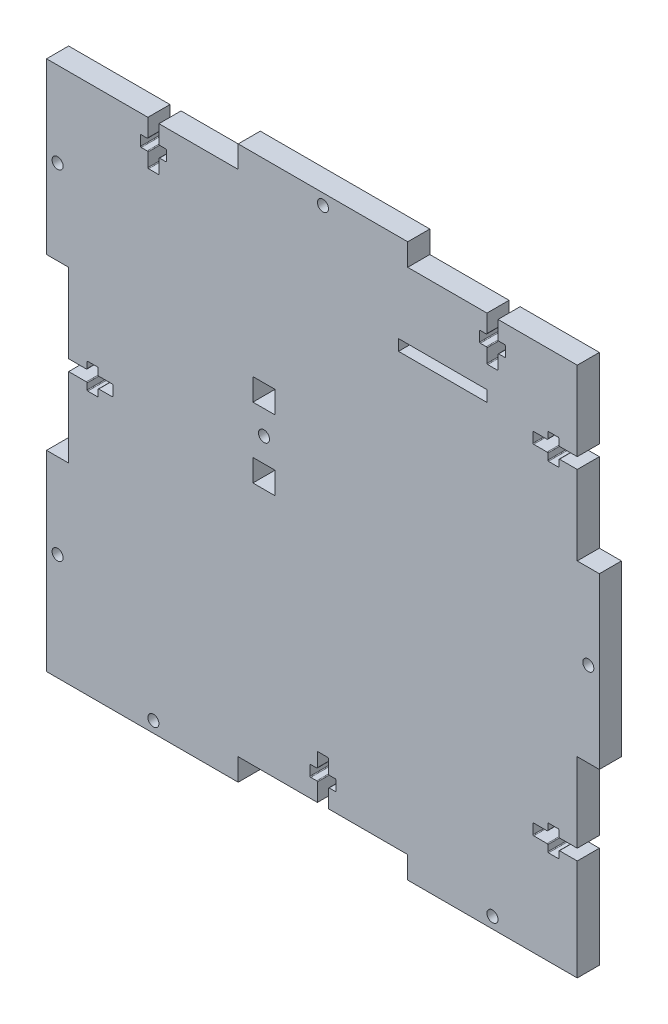
from build123d import *

# Parameters (mm, degrees)
BOX_SIDE_DEPTH       = 6
SKETCH2_R            = 1.5
SCREW_CUT_OUTS_DEPTH = 107.235587258
SKETCH3_R            = 1.5
SKETCH3_W            = 24
SKETCH3_H            = 3
SKETCH3_W_2          = 6
SKETCH3_H_2          = 6
GROOVES_DEPTH        = 107.235587258


with BuildPart() as part:
    # Sketch1 → Box Side (new body)
    with BuildSketch(Plane.XY):
        Polygon((-69, 69), (-23, 69), (-23, 75), (23, 75), (23, 69), (69, 69), (69, 23), (75, 23), (75, -23), (69, -23), (69, -69), (69, -75), (23, -75), (23, -69), (-23, -69), (-23, -75), (-69, -75), (-75, -75), (-75, -69), (-75, -23), (-69, -23), (-69, 23), (-75, 23), (-75, 69), align=None)
    extrude(amount=BOX_SIDE_DEPTH)

    # Sketch2 → Screw Cut-outs (cut, through all)
    with BuildSketch(Plane.XY.offset(6)):
        with Locations((0, 72)):
            Circle(SKETCH2_R)
        with Locations((72, 0)):
            Circle(SKETCH2_R)
        with Locations((-46, -72)):
            Circle(SKETCH2_R)
        with Locations((46, -72)):
            Circle(SKETCH2_R)
        with Locations((-72, 46)):
            Circle(SKETCH2_R)
        with Locations((-72, -46)):
            Circle(SKETCH2_R)
        with BuildLine():
            Line((-44.5, 69), (-44.5, 64.2))
            ThreePointArc((-44.5, 64.2), (-44.441421356, 64.058578644), (-44.3, 64))
            Line((-44.3, 64), (-42.7, 64))
            ThreePointArc((-42.7, 64), (-42.558578644, 63.941421356), (-42.5, 63.8))
            Line((-42.5, 63.8), (-42.5, 61.2))
            ThreePointArc((-42.5, 61.2), (-42.558578644, 61.058578644), (-42.7, 61))
            Line((-42.7, 61), (-44.3, 61))
            ThreePointArc((-44.3, 61), (-44.441421356, 60.941421356), (-44.5, 60.8))
            Line((-44.5, 60.8), (-44.5, 57.2))
            ThreePointArc((-44.5, 57.2), (-44.558578644, 57.058578644), (-44.7, 57))
            Line((-44.7, 57), (-47.3, 57))
            ThreePointArc((-47.3, 57), (-47.441421356, 57.058578644), (-47.5, 57.2))
            Line((-47.5, 57.2), (-47.5, 60.8))
            ThreePointArc((-47.5, 60.8), (-47.558578644, 60.941421356), (-47.7, 61))
            Line((-47.7, 61), (-49.3, 61))
            ThreePointArc((-49.3, 61), (-49.441421356, 61.058578644), (-49.5, 61.2))
            Line((-49.5, 61.2), (-49.5, 63.8))
            ThreePointArc((-49.5, 63.8), (-49.441421356, 63.941421356), (-49.3, 64))
            Line((-49.3, 64), (-47.7, 64))
            ThreePointArc((-47.7, 64), (-47.558578644, 64.058578644), (-47.5, 64.2))
            Line((-47.5, 64.2), (-47.5, 69))
            Line((-47.5, 69), (-44.5, 69))
        make_face()
        with BuildLine():
            Line((47.5, 69), (47.5, 64.2))
            ThreePointArc((47.5, 64.2), (47.558578644, 64.058578644), (47.7, 64))
            Line((47.7, 64), (49.3, 64))
            ThreePointArc((49.3, 64), (49.441421356, 63.941421356), (49.5, 63.8))
            Line((49.5, 63.8), (49.5, 61.2))
            ThreePointArc((49.5, 61.2), (49.441421356, 61.058578644), (49.3, 61))
            Line((49.3, 61), (47.7, 61))
            ThreePointArc((47.7, 61), (47.558578644, 60.941421356), (47.5, 60.8))
            Line((47.5, 60.8), (47.5, 57.2))
            ThreePointArc((47.5, 57.2), (47.441421356, 57.058578644), (47.3, 57))
            Line((47.3, 57), (44.7, 57))
            ThreePointArc((44.7, 57), (44.558578644, 57.058578644), (44.5, 57.2))
            Line((44.5, 57.2), (44.5, 60.8))
            ThreePointArc((44.5, 60.8), (44.441421356, 60.941421356), (44.3, 61))
            Line((44.3, 61), (42.7, 61))
            ThreePointArc((42.7, 61), (42.558578644, 61.058578644), (42.5, 61.2))
            Line((42.5, 61.2), (42.5, 63.8))
            ThreePointArc((42.5, 63.8), (42.558578644, 63.941421356), (42.7, 64))
            Line((42.7, 64), (44.3, 64))
            ThreePointArc((44.3, 64), (44.441421356, 64.058578644), (44.5, 64.2))
            Line((44.5, 64.2), (44.5, 69))
            Line((44.5, 69), (47.5, 69))
        make_face()
        with BuildLine():
            Line((69, 44.5), (64.2, 44.5))
            ThreePointArc((64.2, 44.5), (64.058578644, 44.441421356), (64, 44.3))
            Line((64, 44.3), (64, 42.7))
            ThreePointArc((64, 42.7), (63.941421356, 42.558578644), (63.8, 42.5))
            Line((63.8, 42.5), (61.2, 42.5))
            ThreePointArc((61.2, 42.5), (61.058578644, 42.558578644), (61, 42.7))
            Line((61, 42.7), (61, 44.3))
            ThreePointArc((61, 44.3), (60.941421356, 44.441421356), (60.8, 44.5))
            Line((60.8, 44.5), (57.2, 44.5))
            ThreePointArc((57.2, 44.5), (57.058578644, 44.558578644), (57, 44.7))
            Line((57, 44.7), (57, 47.3))
            ThreePointArc((57, 47.3), (57.058578644, 47.441421356), (57.2, 47.5))
            Line((57.2, 47.5), (60.8, 47.5))
            ThreePointArc((60.8, 47.5), (60.941421356, 47.558578644), (61, 47.7))
            Line((61, 47.7), (61, 49.3))
            ThreePointArc((61, 49.3), (61.058578644, 49.441421356), (61.2, 49.5))
            Line((61.2, 49.5), (63.8, 49.5))
            ThreePointArc((63.8, 49.5), (63.941421356, 49.441421356), (64, 49.3))
            Line((64, 49.3), (64, 47.7))
            ThreePointArc((64, 47.7), (64.058578644, 47.558578644), (64.2, 47.5))
            Line((64.2, 47.5), (69, 47.5))
            Line((69, 47.5), (69, 44.5))
        make_face()
        with BuildLine():
            Line((69, -47.5), (64.2, -47.5))
            ThreePointArc((64.2, -47.5), (64.058578644, -47.558578644), (64, -47.7))
            Line((64, -47.7), (64, -49.3))
            ThreePointArc((64, -49.3), (63.941421356, -49.441421356), (63.8, -49.5))
            Line((63.8, -49.5), (61.2, -49.5))
            ThreePointArc((61.2, -49.5), (61.058578644, -49.441421356), (61, -49.3))
            Line((61, -49.3), (61, -47.7))
            ThreePointArc((61, -47.7), (60.941421356, -47.558578644), (60.8, -47.5))
            Line((60.8, -47.5), (57.2, -47.5))
            ThreePointArc((57.2, -47.5), (57.058578644, -47.441421356), (57, -47.3))
            Line((57, -47.3), (57, -44.7))
            ThreePointArc((57, -44.7), (57.058578644, -44.558578644), (57.2, -44.5))
            Line((57.2, -44.5), (60.8, -44.5))
            ThreePointArc((60.8, -44.5), (60.941421356, -44.441421356), (61, -44.3))
            Line((61, -44.3), (61, -42.7))
            ThreePointArc((61, -42.7), (61.058578644, -42.558578644), (61.2, -42.5))
            Line((61.2, -42.5), (63.8, -42.5))
            ThreePointArc((63.8, -42.5), (63.941421356, -42.558578644), (64, -42.7))
            Line((64, -42.7), (64, -44.3))
            ThreePointArc((64, -44.3), (64.058578644, -44.441421356), (64.2, -44.5))
            Line((64.2, -44.5), (69, -44.5))
            Line((69, -44.5), (69, -47.5))
        make_face()
        with BuildLine():
            Line((-1.5, -69), (1.5, -69))
            Line((1.5, -69), (1.5, -64.2))
            ThreePointArc((1.5, -64.2), (1.558578644, -64.058578644), (1.7, -64))
            Line((1.7, -64), (3.3, -64))
            ThreePointArc((3.3, -64), (3.441421356, -63.941421356), (3.5, -63.8))
            Line((3.5, -63.8), (3.5, -61.2))
            ThreePointArc((3.5, -61.2), (3.441421356, -61.058578644), (3.3, -61))
            Line((3.3, -61), (1.7, -61))
            ThreePointArc((1.7, -61), (1.558578644, -60.941421356), (1.5, -60.8))
            Line((1.5, -60.8), (1.5, -57.2))
            ThreePointArc((1.5, -57.2), (1.441421356, -57.058578644), (1.3, -57))
            Line((1.3, -57), (-1.3, -57))
            ThreePointArc((-1.3, -57), (-1.441421356, -57.058578644), (-1.5, -57.2))
            Line((-1.5, -57.2), (-1.5, -60.8))
            ThreePointArc((-1.5, -60.8), (-1.558578644, -60.941421356), (-1.7, -61))
            Line((-1.7, -61), (-3.3, -61))
            ThreePointArc((-3.3, -61), (-3.441421356, -61.058578644), (-3.5, -61.2))
            Line((-3.5, -61.2), (-3.5, -63.8))
            ThreePointArc((-3.5, -63.8), (-3.441421356, -63.941421356), (-3.3, -64))
            Line((-3.3, -64), (-1.7, -64))
            ThreePointArc((-1.7, -64), (-1.558578644, -64.058578644), (-1.5, -64.2))
            Line((-1.5, -64.2), (-1.5, -69))
        make_face()
        with BuildLine():
            Line((-69, -1.5), (-64.2, -1.5))
            ThreePointArc((-64.2, -1.5), (-64.058578644, -1.558578644), (-64, -1.7))
            Line((-64, -1.7), (-64, -3.3))
            ThreePointArc((-64, -3.3), (-63.941421356, -3.441421356), (-63.8, -3.5))
            Line((-63.8, -3.5), (-61.2, -3.5))
            ThreePointArc((-61.2, -3.5), (-61.058578644, -3.441421356), (-61, -3.3))
            Line((-61, -3.3), (-61, -1.7))
            ThreePointArc((-61, -1.7), (-60.941421356, -1.558578644), (-60.8, -1.5))
            Line((-60.8, -1.5), (-57.2, -1.5))
            ThreePointArc((-57.2, -1.5), (-57.058578644, -1.441421356), (-57, -1.3))
            Line((-57, -1.3), (-57, 1.3))
            ThreePointArc((-57, 1.3), (-57.058578644, 1.441421356), (-57.2, 1.5))
            Line((-57.2, 1.5), (-60.8, 1.5))
            ThreePointArc((-60.8, 1.5), (-60.941421356, 1.558578644), (-61, 1.7))
            Line((-61, 1.7), (-61, 3.3))
            ThreePointArc((-61, 3.3), (-61.058578644, 3.441421356), (-61.2, 3.5))
            Line((-61.2, 3.5), (-63.8, 3.5))
            ThreePointArc((-63.8, 3.5), (-63.941421356, 3.441421356), (-64, 3.3))
            Line((-64, 3.3), (-64, 1.7))
            ThreePointArc((-64, 1.7), (-64.058578644, 1.558578644), (-64.2, 1.5))
            Line((-64.2, 1.5), (-69, 1.5))
            Line((-69, 1.5), (-69, -1.5))
        make_face()
    extrude(amount=-SCREW_CUT_OUTS_DEPTH, mode=Mode.SUBTRACT)

    # Sketch3 → Grooves (cut, through all)
    with BuildSketch(Plane.XY.offset(6)):
        with Locations((-16, 9.82)):
            Circle(SKETCH3_R)
        with Locations((32.5, 49.5)):
            Rectangle(SKETCH3_W, SKETCH3_H)
        with Locations((-16, 19.32)):
            Rectangle(SKETCH3_W_2, SKETCH3_H_2)
        with Locations((-16, 0.32)):
            Rectangle(SKETCH3_W_2, SKETCH3_H_2)
    extrude(amount=-GROOVES_DEPTH, mode=Mode.SUBTRACT)


solid = part.part
